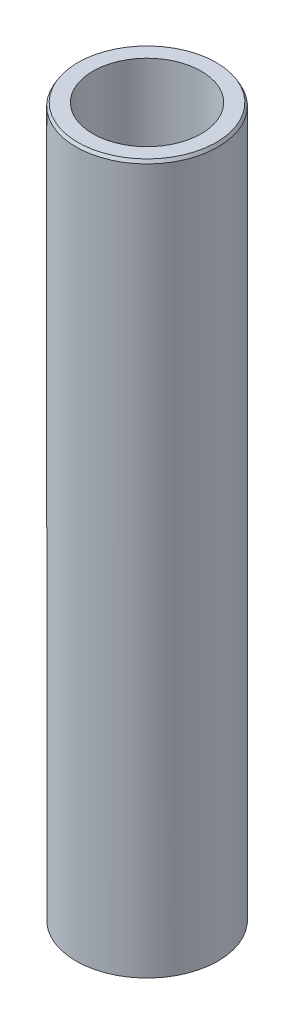
from build123d import *
from OCP.BRepFilletAPI import BRepFilletAPI_MakeChamfer

# Parameters (mm, degrees)
SKETCH1_R           = 60
BOSS_EXTRUDE1_DEPTH = 600
SKETCH2_R           = 45.830036629
CUT_EXTRUDE1_DEPTH  = 606.970296302
CHAMFER1_SIZE       = 2.604759374
CHAMFER1_SIZE2      = 1.503858525


with BuildPart() as part:
    # Sketch1 → Boss-Extrude1 (new body)
    with BuildSketch(Plane(origin=(0, 0, 0), x_dir=(1, 0, 0), z_dir=(0, 1, 0))):
        Circle(SKETCH1_R)
    extrude(amount=BOSS_EXTRUDE1_DEPTH)

    # Sketch2 → Cut-Extrude1 (cut, through all)
    with BuildSketch(Plane(origin=(0, 0, 0), x_dir=(1, 0, 0), z_dir=(0, 1, 0))):
        Circle(SKETCH2_R)
    extrude(amount=CUT_EXTRUDE1_DEPTH, mode=Mode.SUBTRACT)

    # Chamfer1: one chamfer whose edges measure the first distance from different faces: ONE call of the kernel's chamfer builder (chamfer() names one face for all edges)
    chamfer1_edges_1 = [part.edges().sort_by_distance(p)[0] for p in [
        (-60, 600, 0),
    ]]
    chamfer1_side_1 = [part.faces().sort_by_distance(p)[0] for p in [
        (-60, 300, 0),
    ]]
    chamfer1_edges_2 = [part.edges().sort_by_distance(p)[0] for p in [
        (-60, 0, 0),
    ]]
    chamfer1_side_2 = [part.faces().sort_by_distance(p)[0] for p in [
        (-58.302943725, 0, 0),
    ]]
    chamfer1 = BRepFilletAPI_MakeChamfer(part.part.solid().wrapped)
    for e in chamfer1_edges_1:
        chamfer1.Add(CHAMFER1_SIZE, CHAMFER1_SIZE2, e.wrapped, chamfer1_side_1[0].wrapped)  # the first distance lies on this face
    for e in chamfer1_edges_2:
        chamfer1.Add(CHAMFER1_SIZE, CHAMFER1_SIZE2, e.wrapped, chamfer1_side_2[0].wrapped)  # the first distance lies on this face
    add(Compound.cast(chamfer1.Shape()), mode=Mode.REPLACE)


solid = part.part
